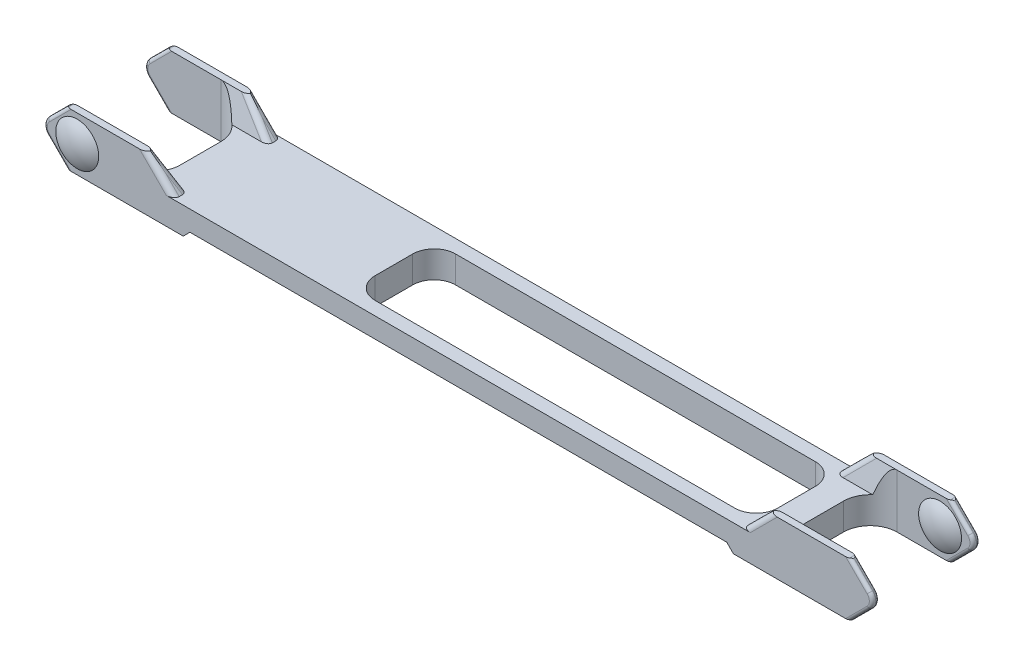
from build123d import *

# Parameters (mm, degrees)
BOSS_EXTRUDE1_DEPTH = 12.7
CUT_EXTRUDE2_DEPTH  = 199.932436772
CUT_EXTRUDE1_DEPTH  = 104.050150898
CUT_EXTRUDE3_DEPTH  = 63.5
CHAMFER1_SIZE       = 1.5875
FILLET1_R           = 0.762
FILLET2_R           = 1.27
CUT_EXTRUDE4_DEPTH  = 100.247182118


# Some blends are built 0.0001 mm under size
with BuildPart() as part:
    # Sketch1 → Boss-Extrude1 (new body)
    with BuildSketch(Plane(origin=(0, 0, 0), x_dir=(1, 0, 0), z_dir=(0, 1, 0))):
        with BuildLine():
            Line((-99.06, -12.7), (99.06, -12.7))
            Line((99.06, -12.7), (99.06, -11.1125))
            Line((99.06, -11.1125), (80.01, -11.1125))
            ThreePointArc((80.01, -11.1125), (75.519871939, -9.252628061), (73.66, -4.7625))
            Line((73.66, -4.7625), (73.66, 4.7625))
            ThreePointArc((73.66, 4.7625), (75.519871939, 9.252628061), (80.01, 11.1125))
            Line((80.01, 11.1125), (99.06, 11.1125))
            Line((99.06, 11.1125), (99.06, 12.7))
            Line((99.06, 12.7), (-99.06, 12.7))
            Line((-99.06, 12.7), (-99.06, 11.1125))
            Line((-99.06, 11.1125), (-80.01, 11.1125))
            ThreePointArc((-80.01, 11.1125), (-75.519871939, 9.252628061), (-73.66, 4.7625))
            Line((-73.66, 4.7625), (-73.66, -4.7625))
            ThreePointArc((-73.66, -4.7625), (-75.519871939, -9.252628061), (-80.01, -11.1125))
            Line((-80.01, -11.1125), (-99.06, -11.1125))
            Line((-99.06, -11.1125), (-99.06, -12.7))
        make_face()
    extrude(amount=BOSS_EXTRUDE1_DEPTH)

    # Sketch3 → Cut-Extrude2 (cut, through all)
    with BuildSketch(Plane.ZY.offset(99.06)):
        Polygon((11.1125, 12.7), (4.7625, 12.7), (-4.7625, 12.7), (-11.1125, 12.7), (-9.525, 6.35), (9.525, 6.35), align=None)
    extrude(amount=-CUT_EXTRUDE2_DEPTH, mode=Mode.SUBTRACT)

    # Sketch2 → Cut-Extrude1 (cut, through all)
    with BuildSketch(Plane.XY.offset(12.7)):
        Polygon((73.66, 12.7), (-73.66, 12.7), (-67.31, 6.35), (67.31, 6.35), align=None)
        with BuildLine():
            Line((97.263948776, 4.553948776), (92.71, 0))
            Line((92.71, 0), (99.06, 0))
            Line((99.06, 0), (99.06, 12.7))
            Line((99.06, 12.7), (92.71, 12.7))
            Line((92.71, 12.7), (97.263948776, 8.146051224))
            ThreePointArc((97.263948776, 8.146051224), (98.007897552, 6.35), (97.263948776, 4.553948776))
        make_face()
        with BuildLine():
            ThreePointArc((-97.263948776, 4.553948776), (-98.007897552, 6.35), (-97.263948776, 8.146051224))
            Line((-97.263948776, 8.146051224), (-92.71, 12.7))
            Line((-92.71, 12.7), (-99.06, 12.7))
            Line((-99.06, 12.7), (-99.06, 0))
            Line((-99.06, 0), (-92.71, 0))
            Line((-92.71, 0), (-97.263948776, 4.553948776))
        make_face()
    extrude(amount=-CUT_EXTRUDE1_DEPTH, mode=Mode.SUBTRACT)

    # Sketch4 → Revolve1 (revolve)
    with BuildSketch(Plane.ZY.offset(90.17)):
        with BuildLine():
            Line((12.7, 6.35), (12.7, 11.43))
            ThreePointArc((12.7, 11.43), (13.881381744, 9.01113492), (14.2875, 6.35))
            Line((14.2875, 6.35), (12.7, 6.35))
        make_face()
    revolve1 = revolve(axis=Axis((-90.17, 6.35, 0), (0, 0, 1)))

    # Mirror1: Revolve1 across plane
    add(revolve1.mirror(Plane.XY))

    # Sketch5 → Revolve2 (revolve)
    with BuildSketch(Plane(origin=(90.17, 0, 0), x_dir=(0, 0, -1), z_dir=(1, 0, 0))):
        with BuildLine():
            Line((11.1125, 6.35), (11.1125, 11.43))
            ThreePointArc((11.1125, 11.43), (9.931118256, 9.01113492), (9.525, 6.35))
            Line((9.525, 6.35), (11.1125, 6.35))
        make_face()
    revolve2 = revolve(axis=Axis((90.17, 6.35, 0), (0, 0, -1)))

    # Mirror2: Revolve2 across plane
    add(revolve2.mirror(Plane.XY))

    # Sketch6 → Cut-Extrude3 (cut, symmetric)
    with BuildSketch(Plane(origin=(0, 0, 0), x_dir=(0, 0, -1), z_dir=(1, 0, 0))):
        Polygon((-12.7, 0), (-11.1125, 0), (-12.7, 1.5875), align=None)
        Polygon((11.1125, 0), (12.7, 1.5875), (12.7, 0), align=None)
    extrude(amount=CUT_EXTRUDE3_DEPTH, both=True, mode=Mode.SUBTRACT)

    # Chamfer1
    chamfer1_edges = [part.edges().sort_by_distance(p)[0] for p in [
        (63.5, 0, 11.90625),
        (63.5, 0, -11.90625),
        (-63.5, 0, -11.90625),
        (-63.5, 0, 11.90625),
    ]]
    chamfer(chamfer1_edges, length=CHAMFER1_SIZE - 0.0001)  # a hair under: the kernel refuses the full size

    # Fillet1
    fillet1_edges = [part.edges().sort_by_distance(p)[0] for p in [
        (-98.007897552, 6.35, 12.7),
        (-92.71, 12.7, -11.90625),
        (-94.986974388, 10.423025612, -11.1125),
        (-94.986974388, 10.423025612, -12.7),
        (-94.986974388, 10.423025612, 11.1125),
        (-92.71, 12.7, 11.90625),
        (-94.986974388, 2.276974388, 12.7),
        (-98.007897552, 6.35, -11.1125),
        (-98.007897552, 6.35, 11.1125),
        (-94.986974388, 2.276974388, -11.1125),
        (-94.986974388, 2.276974388, 11.1125),
        (-98.007897552, 6.35, -12.7),
        (-94.986974388, 2.276974388, -12.7),
        (-94.986974388, 10.423025612, 12.7),
        (98.007897552, 6.35, 12.7),
        (92.71, 12.7, 11.90625),
        (92.71, 12.7, -11.90625),
        (94.986974388, 10.423025612, 12.7),
        (94.986974388, 2.276974388, 11.1125),
        (94.986974388, 2.276974388, -11.1125),
        (94.986974388, 2.276974388, -12.7),
        (98.007897552, 6.35, 11.1125),
        (94.986974388, 10.423025612, 11.1125),
        (94.986974388, 10.423025612, -11.1125),
        (98.007897552, 6.35, -12.7),
        (94.986974388, 10.423025612, -12.7),
        (94.986974388, 2.276974388, 12.7),
        (98.007897552, 6.35, -11.1125),
    ]]
    fillet(fillet1_edges, radius=FILLET1_R)

    # Fillet2
    # the kernel refuses this fillet: 1.27 mm, written as the material it takes off along each edge
    with BuildSketch(Plane(origin=(-75.90506403, 14.94506403, -12.7), x_dir=(-0.7071067811865446, -0.7071067811865505, 0), z_dir=(0.7071067811865506, -0.7071067811865446, 0))) as fillet2_piece_1_section:
        with BuildLine():
            CenterArc((FILLET2_R, -FILLET2_R), FILLET2_R, 90, 90)
            Line((0, -FILLET2_R), (0, 0))
            Line((0, 0), (FILLET2_R, 0))
        make_face()
    fillet2_piece_1 = extrude(amount=15.330256121, mode=Mode.PRIVATE)
    fillet2_piece_1 = split(fillet2_piece_1, bisect_by=Plane(origin=(-71.905795305, 6.35, -12.408746665), z_dir=(0, 1, 0)), keep=Keep.TOP, mode=Mode.PRIVATE)
    add(fillet2_piece_1, mode=Mode.SUBTRACT)
    with BuildSketch(Plane(origin=(-65.450815483, 4.490815483, -9.060203871), x_dir=(0.1230914909792504, -0.12309149097924957, -0.9847319278346824), z_dir=(-0.696310623822809, 0.6963106238228031, -0.17407765595558086))) as fillet2_piece_2_section:
        with BuildLine():
            CenterArc((FILLET2_R * 0.840960781889, FILLET2_R), FILLET2_R, 189.874961398, 80.125038602)
            Line((-FILLET2_R * 0.144223584254, FILLET2_R * 0.828501414858), (0, 0))
            Line((0, 0), (FILLET2_R * 0.840960781889, 0))
        make_face()
    fillet2_piece_2 = extrude(amount=14.459594166, mode=Mode.PRIVATE)
    fillet2_piece_2 = split(fillet2_piece_2, bisect_by=Plane(origin=(-71.646234354, 6.35, -10.770930609), z_dir=(0, 1, 0)), keep=Keep.TOP, mode=Mode.PRIVATE)
    add(fillet2_piece_2, mode=Mode.SUBTRACT)
    with BuildSketch(Plane(origin=(-75.519184517, 14.559184517, 11.577296129), x_dir=(-0.7177405625652845, -0.6755205294731655, -0.1688801323683837), z_dir=(0.69631062382278, -0.6963106238227741, -0.17407765595581334))) as fillet2_piece_3_section:
        with BuildLine():
            CenterArc((FILLET2_R * 0.840960781889, -FILLET2_R), FILLET2_R, 90, 80.125038602)
            Line((-FILLET2_R * 0.144223584254, -FILLET2_R * 0.828501414857), (0, 0))
            Line((0, 0), (FILLET2_R * 0.840960781889, 0))
        make_face()
    fillet2_piece_3 = extrude(amount=14.459594166, mode=Mode.PRIVATE)
    fillet2_piece_3 = split(fillet2_piece_3, bisect_by=Plane(origin=(-71.646234354, 6.35, 10.770930609), z_dir=(0, 1, 0)), keep=Keep.TOP, mode=Mode.PRIVATE)
    add(fillet2_piece_3, mode=Mode.SUBTRACT)
    with BuildSketch(Plane(origin=(-75.90506403, 14.94506403, 12.7), x_dir=(-0.7071067811865445, -0.7071067811865505, 0), z_dir=(0.7071067811865506, -0.7071067811865446, 0))) as fillet2_piece_4_section:
        with BuildLine():
            CenterArc((FILLET2_R, FILLET2_R), FILLET2_R, 180, 90)
            Line((0, FILLET2_R), (0, 0))
            Line((0, 0), (FILLET2_R, 0))
        make_face()
    fillet2_piece_4 = extrude(amount=15.330256121, mode=Mode.PRIVATE)
    fillet2_piece_4 = split(fillet2_piece_4, bisect_by=Plane(origin=(-71.905795305, 6.35, 12.408746665), z_dir=(0, 1, 0)), keep=Keep.TOP, mode=Mode.PRIVATE)
    add(fillet2_piece_4, mode=Mode.SUBTRACT)
    with BuildSketch(Plane(origin=(65.06493597, 4.10493597, -12.7), x_dir=(0.7071067811865445, -0.7071067811865506, 0), z_dir=(0.7071067811865506, 0.7071067811865445, 0))) as fillet2_piece_5_section:
        with BuildLine():
            CenterArc((FILLET2_R, -FILLET2_R), FILLET2_R, 90, 90)
            Line((0, -FILLET2_R), (0, 0))
            Line((0, 0), (FILLET2_R, 0))
        make_face()
    fillet2_piece_5 = extrude(amount=15.330256121, mode=Mode.PRIVATE)
    fillet2_piece_5 = split(fillet2_piece_5, bisect_by=Plane(origin=(71.905795305, 6.35, -12.408746665), z_dir=(0, 1, 0)), keep=Keep.TOP, mode=Mode.PRIVATE)
    add(fillet2_piece_5, mode=Mode.SUBTRACT)
    with BuildSketch(Plane(origin=(75.519184517, 14.559184517, -11.577296129), x_dir=(-0.12309149097927001, -0.12309149097926336, -0.9847319278346782), z_dir=(-0.6963106238228061, -0.6963106238228001, 0.17407765595560445))) as fillet2_piece_6_section:
        with BuildLine():
            CenterArc((FILLET2_R * 0.840960781889, FILLET2_R), FILLET2_R, 189.874961398, 80.125038602)
            Line((-FILLET2_R * 0.144223584254, FILLET2_R * 0.828501414858), (0, 0))
            Line((0, 0), (FILLET2_R * 0.84096078189, 0))
        make_face()
    fillet2_piece_6 = extrude(amount=14.459594166, mode=Mode.PRIVATE)
    fillet2_piece_6 = split(fillet2_piece_6, bisect_by=Plane(origin=(71.646234354, 6.35, -10.770930609), z_dir=(0, 1, 0)), keep=Keep.TOP, mode=Mode.PRIVATE)
    add(fillet2_piece_6, mode=Mode.SUBTRACT)
    with BuildSketch(Plane(origin=(65.06493597, 4.10493597, 12.7), x_dir=(0.7071067811865445, -0.7071067811865507, 0), z_dir=(0.7071067811865506, 0.7071067811865445, 0))) as fillet2_piece_7_section:
        with BuildLine():
            CenterArc((FILLET2_R, FILLET2_R), FILLET2_R, 180, 90)
            Line((0, FILLET2_R), (0, 0))
            Line((0, 0), (FILLET2_R, 0))
        make_face()
    fillet2_piece_7 = extrude(amount=15.330256121, mode=Mode.PRIVATE)
    fillet2_piece_7 = split(fillet2_piece_7, bisect_by=Plane(origin=(71.905795305, 6.35, 12.408746665), z_dir=(0, 1, 0)), keep=Keep.TOP, mode=Mode.PRIVATE)
    add(fillet2_piece_7, mode=Mode.SUBTRACT)
    with BuildSketch(Plane(origin=(65.450815483, 4.490815483, 9.060203871), x_dir=(0.7177405625652817, -0.6755205294731627, -0.16888013236840813), z_dir=(0.6963106238227829, 0.6963106238227769, 0.1740776559557897))) as fillet2_piece_8_section:
        with BuildLine():
            CenterArc((FILLET2_R * 0.840960781889, -FILLET2_R), FILLET2_R, 90, 80.125038602)
            Line((-FILLET2_R * 0.144223584254, -FILLET2_R * 0.828501414857), (0, 0))
            Line((0, 0), (FILLET2_R * 0.840960781889, 0))
        make_face()
    fillet2_piece_8 = extrude(amount=14.459594166, mode=Mode.PRIVATE)
    fillet2_piece_8 = split(fillet2_piece_8, bisect_by=Plane(origin=(71.646234354, 6.35, 10.770930609), z_dir=(0, 1, 0)), keep=Keep.TOP, mode=Mode.PRIVATE)
    add(fillet2_piece_8, mode=Mode.SUBTRACT)

    # Sketch7 → Cut-Extrude4 (cut, through all)
    with BuildSketch(Plane(origin=(0, 6.35, 0), x_dir=(1, 0, 0), z_dir=(0, 1, 0))):
        with BuildLine():
            Line((-22.86, 9.525), (62.23, 9.525))
            ThreePointArc((62.23, 9.525), (65.822102448, 8.037102448), (67.31, 4.445))
            Line((67.31, 4.445), (67.31, -4.445))
            ThreePointArc((67.31, -4.445), (65.822102448, -8.037102448), (62.23, -9.525))
            Line((62.23, -9.525), (-22.86, -9.525))
            ThreePointArc((-22.86, -9.525), (-26.452102448, -8.037102448), (-27.94, -4.445))
            Line((-27.94, -4.445), (-27.94, 4.445))
            ThreePointArc((-27.94, 4.445), (-26.452102448, 8.037102448), (-22.86, 9.525))
        make_face()
    extrude(amount=-CUT_EXTRUDE4_DEPTH, mode=Mode.SUBTRACT)


solid = part.part
